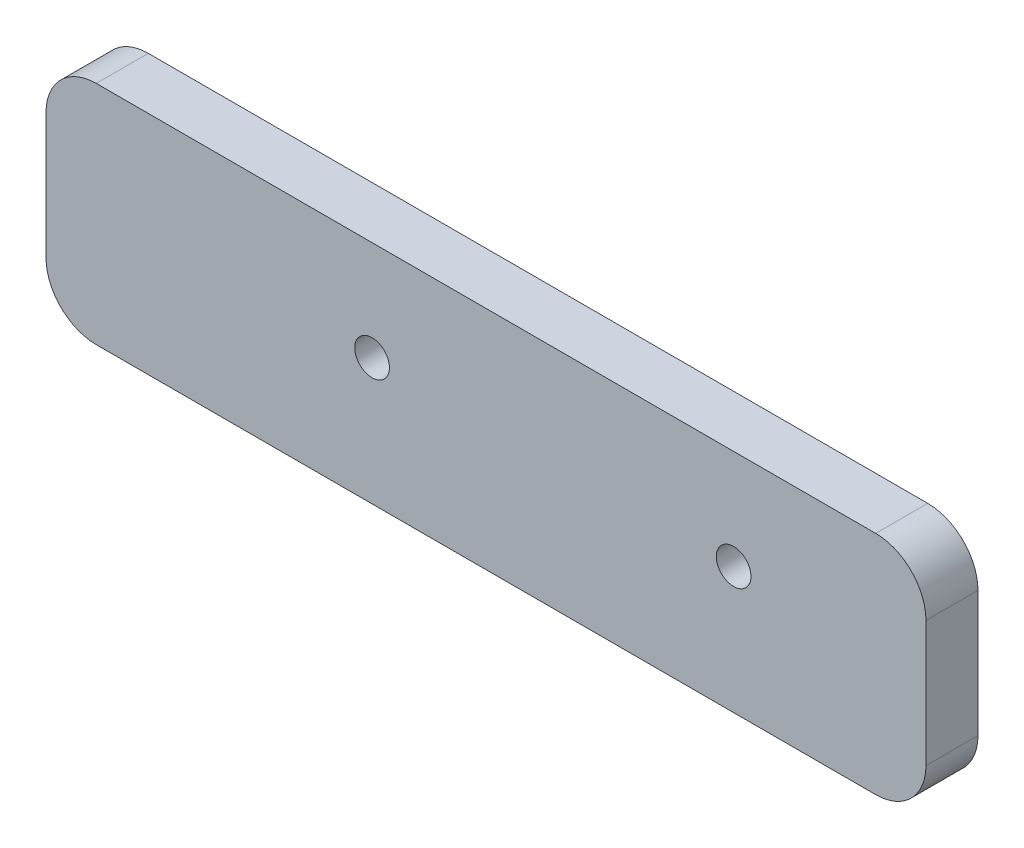
from build123d import *

# Parameters (mm, degrees)
SKETCH1_W           = 88.9
SKETCH1_H           = 22.86
BOSS_EXTRUDE1_DEPTH = 5.2578
FILLET1_R           = 5.08
FILLET2_R           = 5.08
FILLET3_R           = 5.08
FILLET4_R           = 5.08
CAVITY1_OUTLINE_R   = 1.7526
CAVITY1_DEPTH       = 5.2578


# Read off the part's stored shape, not the designer's step: Cavity1
with BuildPart() as part:
    # Sketch1 → Boss-Extrude1 (new body)
    with BuildSketch(Plane.XY):
        Rectangle(SKETCH1_W, SKETCH1_H)
    extrude(amount=BOSS_EXTRUDE1_DEPTH)

    # Fillet1
    fillet1_edges = [part.edges().sort_by_distance(p)[0] for p in [
        (-44.45, 11.43, 2.6289),
    ]]
    fillet(fillet1_edges, radius=FILLET1_R)

    # Fillet2
    fillet2_edges = [part.edges().sort_by_distance(p)[0] for p in [
        (44.45, 11.43, 2.6289),
    ]]
    fillet(fillet2_edges, radius=FILLET2_R)

    # Fillet3
    fillet3_edges = [part.edges().sort_by_distance(p)[0] for p in [
        (44.45, -11.43, 2.6289),
    ]]
    fillet(fillet3_edges, radius=FILLET3_R)

    # Fillet4
    fillet4_edges = [part.edges().sort_by_distance(p)[0] for p in [
        (-44.45, -11.43, 2.6289),
    ]]
    fillet(fillet4_edges, radius=FILLET4_R)

    # Cavity1 outline → Cavity1 (cut)
    with BuildSketch(Plane.XY):
        with Locations((25.019, 1.3589)):
            Circle(CAVITY1_OUTLINE_R)
        with Locations((-11.5062, 1.3589)):
            Circle(CAVITY1_OUTLINE_R)
    extrude(amount=CAVITY1_DEPTH, mode=Mode.SUBTRACT)


solid = part.part
